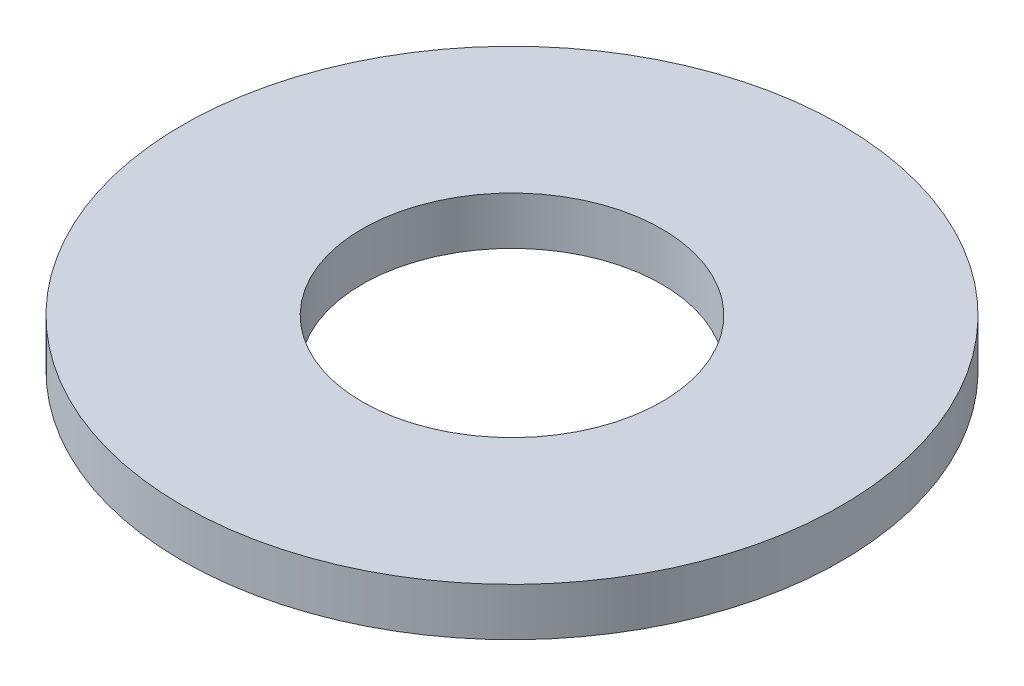
from build123d import *

# Parameters (mm, degrees)
SKETCH1_R           = 82.5
BOSS_EXTRUDE1_DEPTH = 12
SKETCH2_R           = 37.5
CUT_EXTRUDE1_DEPTH  = 118.288106814


with BuildPart() as part:
    # Sketch1 → Boss-Extrude1 (new body)
    with BuildSketch(Plane(origin=(0, 0, 0), x_dir=(1, 0, 0), z_dir=(0, 1, 0))):
        Circle(SKETCH1_R)
    extrude(amount=BOSS_EXTRUDE1_DEPTH)

    # Sketch2 → Cut-Extrude1 (cut, through all)
    with BuildSketch(Plane(origin=(0, 0, 0), x_dir=(1, 0, 0), z_dir=(0, 1, 0))):
        Circle(SKETCH2_R)
    extrude(amount=CUT_EXTRUDE1_DEPTH, mode=Mode.SUBTRACT)


solid = part.part
